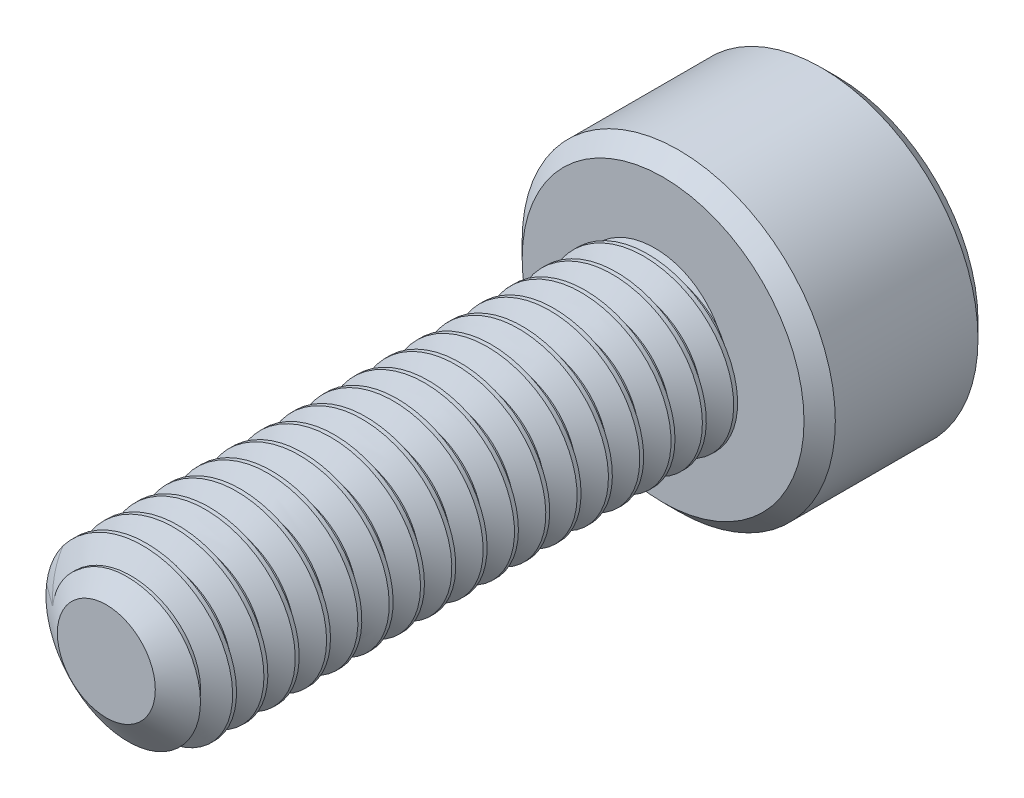
from build123d import *

# Parameters (mm, degrees)
SKETCH1_R          = 1.25
EXTRUDE1_DEPTH     = 8
CUT_SWEEP1_PITCH   = 0.45
SKETCH6_R          = 2.25
EXTRUDE2_DEPTH     = 2.5
CUT_EXTRUDE1_DEPTH = 1.5
CHAMFER1_SIZE      = 0.225


with BuildPart() as part:
    # Sketch1 → Extrude1 (new body)
    with BuildSketch(Plane.XY):
        Circle(SKETCH1_R)
    extrude(amount=-EXTRUDE1_DEPTH)

    # Cut-Sweep1: the profile of Sketch3 profile screwed along a right-hand helix of 18.777778 turns, 6 arcs to a turn; built about Z, then put on its axis
    cut_sweep1_z = Axis((0, 0, 0), (0, 0, 1))
    cut_sweep1_corners = [(1.2503, 0, -0.393923205), (0.957716426, 0, -0.225), (0.957716426, 0, -0.16875), (1.2503, 0, 0.000173205)]
    with BuildLine(mode=Mode.PRIVATE) as cut_sweep1_profile:
        Line(cut_sweep1_corners[0], cut_sweep1_corners[1])
        Line(cut_sweep1_corners[1], cut_sweep1_corners[2])
        Line(cut_sweep1_corners[2], cut_sweep1_corners[3])
        Line(cut_sweep1_corners[3], cut_sweep1_corners[0])
    cut_sweep1_cap = Face(cut_sweep1_profile.wire())
    cut_sweep1_turn_angles = [0, 30, 60, 90, 120, 150, 180, 210, 240, 270, 300, 330, 360]
    cut_sweep1_turn_weights = [1, 0.8660254037844387, 1, 0.8660254037844387, 1, 0.8660254037844387, 1, 0.8660254037844387, 1, 0.8660254037844387, 1, 0.8660254037844387, 1]
    cut_sweep1_turn_rails = [Edge.make_bspline([Vector(p[0], p[1], 0).rotate(cut_sweep1_z, cut_sweep1_turn_angles[k]) / cut_sweep1_turn_weights[k] + Vector(0, 0, p[2] + CUT_SWEEP1_PITCH * cut_sweep1_turn_angles[k] / 360) for k in range(13)], [0, 0, 0, 1, 1, 2, 2, 3, 3, 4, 4, 5, 5, 6, 6, 6], 2, cut_sweep1_turn_weights) for p in cut_sweep1_corners]
    cut_sweep1_turn_sides = [Face.make_surface_from_curves(cut_sweep1_turn_rails[p[0]], cut_sweep1_turn_rails[p[1]]) for p in [(0, 1), (1, 2), (2, 3), (3, 0)]]
    cut_sweep1_last_angles = [6480, 6510, 6540, 6570, 6600, 6630, 6660, 6690, 6720, 6740, 6760]
    cut_sweep1_last_weights = [1, 0.8660254037844387, 1, 0.8660254037844387, 1, 0.8660254037844387, 1, 0.8660254037844387, 1, 0.939692620785683, 1]
    cut_sweep1_last_rails = [Edge.make_bspline([Vector(p[0], p[1], 0).rotate(cut_sweep1_z, cut_sweep1_last_angles[k]) / cut_sweep1_last_weights[k] + Vector(0, 0, p[2] + CUT_SWEEP1_PITCH * cut_sweep1_last_angles[k] / 360) for k in range(11)], [0, 0, 0, 1, 1, 2, 2, 3, 3, 4, 4, 5, 5, 5], 2, cut_sweep1_last_weights) for p in cut_sweep1_corners]
    cut_sweep1_last_sides = [Face.make_surface_from_curves(cut_sweep1_last_rails[p[0]], cut_sweep1_last_rails[p[1]]) for p in [(0, 1), (1, 2), (2, 3), (3, 0)]]
    cut_sweep1 = Plane(origin=(0, 0, 0), x_dir=(0, 1, 0), z_dir=(0, 0, -1)) * Solid(Shell([*[p.moved(Location((0, 0, CUT_SWEEP1_PITCH * i))) for i in range(18) for p in cut_sweep1_turn_sides], *cut_sweep1_last_sides, cut_sweep1_cap, cut_sweep1_cap.rotate(cut_sweep1_z, 6760).moved(Location((0, 0, CUT_SWEEP1_PITCH * 6760 / 360)))]))
    add(cut_sweep1, mode=Mode.SUBTRACT)

    # Sketch4 → Cut-Revolve1 (revolve, cut)
    with BuildSketch(Plane(origin=(0, 0, 0), x_dir=(0, 0, -1), z_dir=(1, 0, 0)), mode=Mode.PRIVATE) as cut_revolve1_sk:
        Polygon((0.382511876, 1.25), (0, 0.703716426), (0, 1.25), align=None)
    revolve(cut_revolve1_sk.sketch.rotate(Axis((0, 0, 0), (0, 0, -1)), 276.971148597), axis=Axis((0, 0, 0), (0, 0, -1)), mode=Mode.SUBTRACT)

    # Sketch6 → Extrude2 (add)
    with BuildSketch(Plane(origin=(0, 0, -8), x_dir=(-1, 0, 0), z_dir=(0, 0, -1))):
        Circle(SKETCH6_R)
    extrude(amount=EXTRUDE2_DEPTH)

    # Sketch7 → Cut-Extrude1 (cut)
    with BuildSketch(Plane(origin=(0, 0, -10.5), x_dir=(-1, 0, 0), z_dir=(0, 0, -1))):
        Polygon((0, 1.154700538), (-1, 0.577350269), (-1, -0.577350269), (0, -1.154700538), (1, -0.577350269), (1, 0.577350269), align=None)
    extrude(amount=-CUT_EXTRUDE1_DEPTH, mode=Mode.SUBTRACT)

    # Cut-Extrude2 cone 1 section (through the dimple's axis) → Cut-Extrude2 (revolve, cut)
    with BuildSketch(Plane(origin=(0, 0, -10.5), x_dir=(0, 1, 0), z_dir=(1, 0, 0))):
        Polygon((0, 0), (1.154700538, 0), (0, 1.154700538), align=None)
    revolve(axis=Axis((0, 0, -10.5), (0, 0, 1)), mode=Mode.SUBTRACT)

    # Chamfer1
    chamfer1_edges = [part.edges().sort_by_distance(p)[0] for p in [
        (2.25, 0, -8),
        (2.25, 0, -10.5),
    ]]
    chamfer(chamfer1_edges, length=CHAMFER1_SIZE)


solid = part.part
